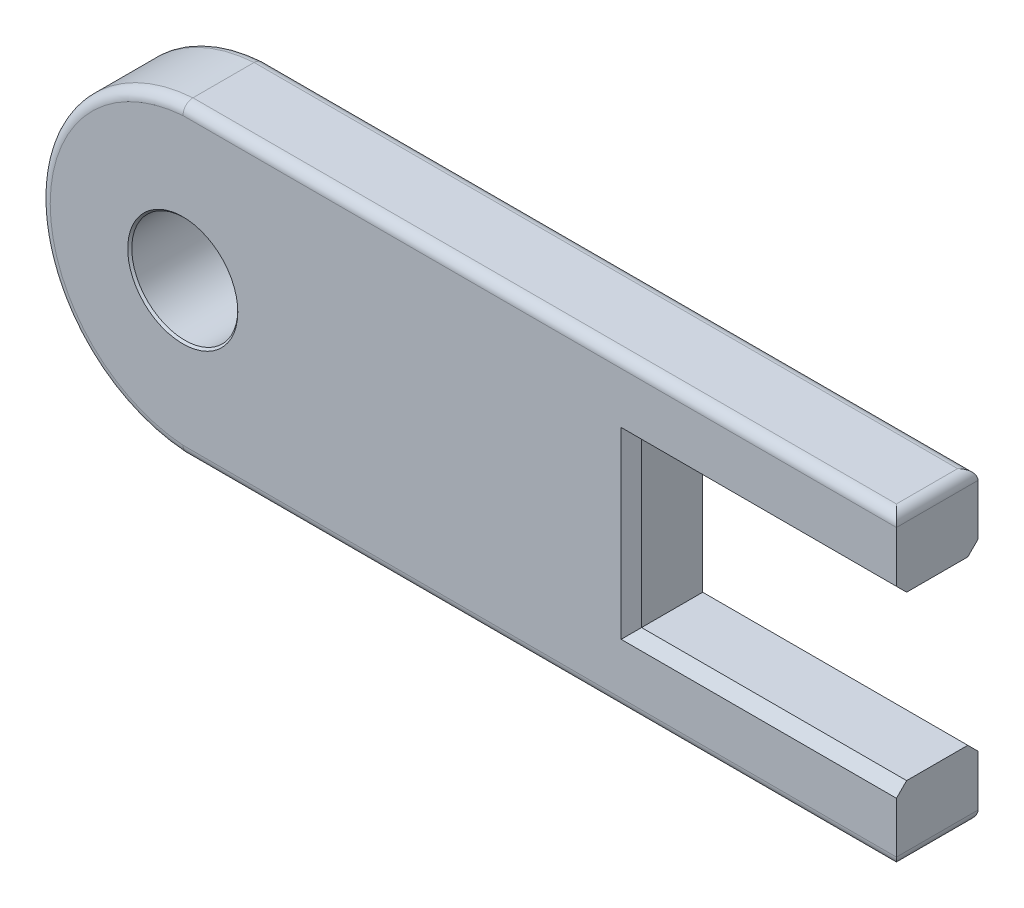
from build123d import *

# Parameters (mm, degrees)
BOSS_EXTRUDE1_DEPTH = 20
SKETCH2_R           = 26
CUT_EXTRUDE1_DEPTH  = 40
FILLET1_R           = 5
CHAMFER1_SIZE       = 1
CHAMFER2_SIZE       = 5


with BuildPart() as part:
    # Sketch1 → Boss-Extrude1 (new, symmetric)
    with BuildSketch(Plane.XY):
        with BuildLine():
            Line((-276.915792692, 75), (73.084207308, 75))
            Line((73.084207308, 75), (73.084207308, 40))
            Line((73.084207308, 40), (-56.915792692, 40))
            Line((-56.915792692, 40), (-56.915792692, -40))
            Line((-56.915792692, -40), (73.084207308, -40))
            Line((73.084207308, -40), (73.084207308, -75))
            Line((73.084207308, -75), (-276.915792692, -75))
            ThreePointArc((-276.915792692, -75), (-346.915792692, 0), (-276.915792692, 75))
        make_face()
    extrude(amount=BOSS_EXTRUDE1_DEPTH, both=True)

    # Sketch2 → Cut-Extrude1 (cut)
    with BuildSketch(Plane.XY.offset(20)):
        with Locations((-276.915792692, 0)):
            Circle(SKETCH2_R)
    extrude(amount=-CUT_EXTRUDE1_DEPTH, mode=Mode.SUBTRACT)

    # Fillet1
    # the kernel refuses this fillet: 5 mm, written as the material it takes off along each edge
    with BuildSketch(Plane(origin=(78.084207308, -75, -20), x_dir=(0, 1, 0), z_dir=(-1, 0, 0)), Plane(origin=(-281.915792692, 75, 20), x_dir=(0, 0, -1), z_dir=(1, 0, 0))) as fillet1_piece_1:
        with BuildLine():
            CenterArc((FILLET1_R, -FILLET1_R), FILLET1_R, 90, 90)
            Line((0, -FILLET1_R), (-FILLET1_R * 0.02, -FILLET1_R))
            Line((-FILLET1_R * 0.02, -FILLET1_R), (-FILLET1_R * 0.02, FILLET1_R * 0.02))
            Line((-FILLET1_R * 0.02, FILLET1_R * 0.02), (FILLET1_R, FILLET1_R * 0.02))
            Line((FILLET1_R, FILLET1_R * 0.02), (FILLET1_R, 0))
        make_face()
    extrude(amount=360, mode=Mode.SUBTRACT)
    with BuildSketch(Plane(origin=(-271.737221263, 0, -20), x_dir=(-0.00233212005306246, -0.9999972806043315, 0), z_dir=(0.9999972806043315, -0.00233212005306246, 0))) as fillet1_piece_2:
        with BuildLine():
            CenterArc((75.178571429 - FILLET1_R, -FILLET1_R), FILLET1_R, 0, 90)
            Line((75.178571429 - FILLET1_R, 0), (75.178571429 - FILLET1_R, FILLET1_R * 0.02))
            Line((75.178571429 - FILLET1_R, FILLET1_R * 0.02), (75.178571429 + FILLET1_R * 0.02, FILLET1_R * 0.02))
            Line((75.178571429 + FILLET1_R * 0.02, FILLET1_R * 0.02), (75.178571429 + FILLET1_R * 0.02, -FILLET1_R))
            Line((75.178571429 + FILLET1_R * 0.02, -FILLET1_R), (75.178571429, -FILLET1_R))
        make_face()
    revolve(axis=Axis((-271.737221263, 0, -20), (0, 0, -1)), revolution_arc=179.732758485, mode=Mode.SUBTRACT)
    with BuildSketch(Plane(origin=(73.084207308, 75, 25), x_dir=(-1, 0, 0), z_dir=(0, 0, -1)), Plane(origin=(73.084207308, -75, -25), x_dir=(-1, 0, 0), z_dir=(0, 0, 1))) as fillet1_piece_3:
        with BuildLine():
            CenterArc((FILLET1_R, -FILLET1_R), FILLET1_R, 90, 90)
            Line((0, -FILLET1_R), (-FILLET1_R * 0.02, -FILLET1_R))
            Line((-FILLET1_R * 0.02, -FILLET1_R), (-FILLET1_R * 0.02, FILLET1_R * 0.02))
            Line((-FILLET1_R * 0.02, FILLET1_R * 0.02), (FILLET1_R, FILLET1_R * 0.02))
            Line((FILLET1_R, FILLET1_R * 0.02), (FILLET1_R, 0))
        make_face()
    extrude(amount=50, mode=Mode.SUBTRACT)
    with BuildSketch(Plane(origin=(-271.737221263, 0, 20), x_dir=(-0.00233212005306246, -0.9999972806043315, 0), z_dir=(0.9999972806043315, -0.00233212005306246, 0))) as fillet1_piece_4:
        with BuildLine():
            CenterArc((75.178571429 - FILLET1_R, FILLET1_R), FILLET1_R, 270, 90)
            Line((75.178571429 - FILLET1_R, 0), (75.178571429 - FILLET1_R, -FILLET1_R * 0.02))
            Line((75.178571429 - FILLET1_R, -FILLET1_R * 0.02), (75.178571429 + FILLET1_R * 0.02, -FILLET1_R * 0.02))
            Line((75.178571429 + FILLET1_R * 0.02, -FILLET1_R * 0.02), (75.178571429 + FILLET1_R * 0.02, FILLET1_R))
            Line((75.178571429 + FILLET1_R * 0.02, FILLET1_R), (75.178571429, FILLET1_R))
        make_face()
    revolve(axis=Axis((-271.737221263, 0, 20), (0, 0, -1)), revolution_arc=179.732758485, mode=Mode.SUBTRACT)
    with BuildSketch(Plane(origin=(78.084207308, -75, 20), x_dir=(0, 1, 0), z_dir=(-1, 0, 0)), Plane(origin=(-281.915792692, 75, -20), x_dir=(0, 0, 1), z_dir=(1, 0, 0))) as fillet1_piece_5:
        with BuildLine():
            CenterArc((FILLET1_R, FILLET1_R), FILLET1_R, 180, 90)
            Line((0, FILLET1_R), (-FILLET1_R * 0.02, FILLET1_R))
            Line((-FILLET1_R * 0.02, FILLET1_R), (-FILLET1_R * 0.02, -FILLET1_R * 0.02))
            Line((-FILLET1_R * 0.02, -FILLET1_R * 0.02), (FILLET1_R, -FILLET1_R * 0.02))
            Line((FILLET1_R, -FILLET1_R * 0.02), (FILLET1_R, 0))
        make_face()
    extrude(amount=360, mode=Mode.SUBTRACT)

    # Chamfer1
    chamfer1_edges = [part.edges().sort_by_distance(p)[0] for p in [
        (-302.915792692, 0, -20),
        (-302.915792692, 0, 20),
    ]]
    chamfer(chamfer1_edges, length=CHAMFER1_SIZE)

    # Chamfer2
    chamfer2_edges = [part.edges().sort_by_distance(p)[0] for p in [
        (8.084207308, -40, 20),
        (-56.915792692, 0, 20),
        (8.084207308, 40, 20),
        (8.084207308, 40, -20),
        (-56.915792692, 0, -20),
        (8.084207308, -40, -20),
    ]]
    chamfer(chamfer2_edges, length=CHAMFER2_SIZE)


solid = part.part
